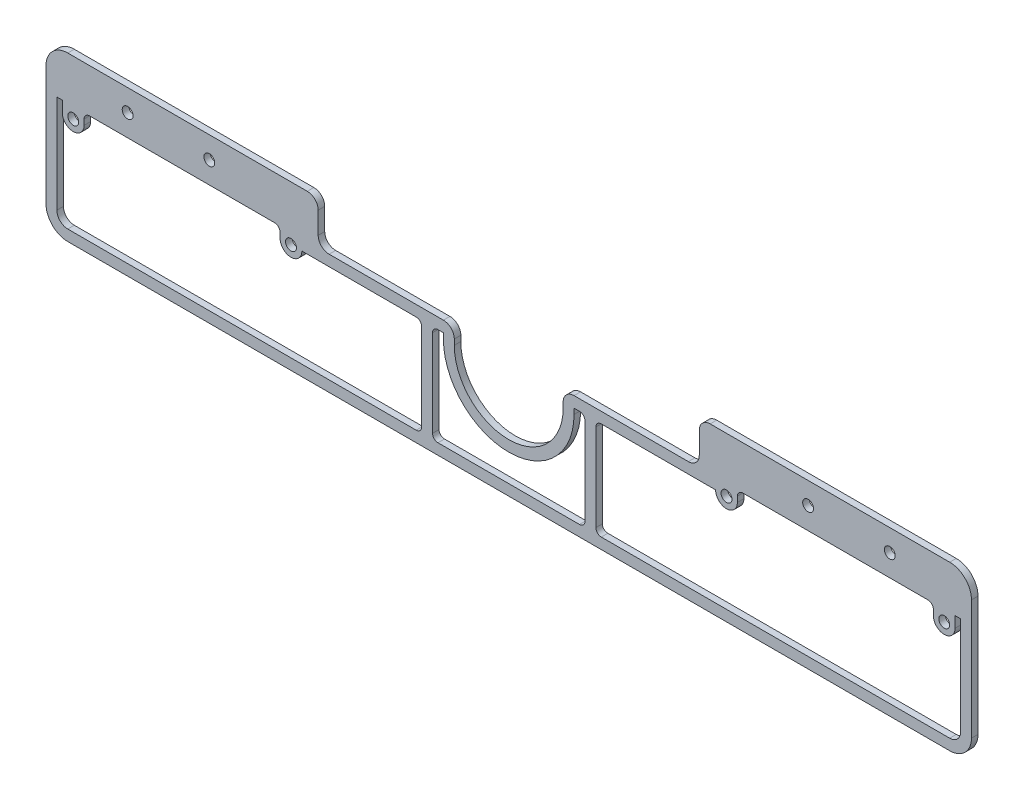
from build123d import *

# Parameters (mm, degrees)
SKETCH1_R           = 5
BOSS_EXTRUDE1_DEPTH = 6
SKETCH2_R           = 5
CUT_EXTRUDE1_DEPTH  = 436.529562716


with BuildPart() as part:
    # Sketch1 → Boss-Extrude1 (new body)
    with BuildSketch(Plane.XY):
        with BuildLine():
            Line((-425, -75), (-425, 35))
            ThreePointArc((-425, 35), (-419.142135624, 49.142135624), (-405, 55))
            Line((-405, 55), (-185.000330481, 55))
            ThreePointArc((-185.000330481, 55), (-177.92926267, 52.071067812), (-175.000330481, 45))
            Line((-175.000330481, 45), (-175.000330481, 25))
            ThreePointArc((-175.000330481, 25), (-172.071398293, 17.928932188), (-165.000330481, 15))
            Line((-165.000330481, 15), (-60, 15))
            ThreePointArc((-60, 15), (-52.928932188, 12.071067812), (-50, 5))
            Line((-50, 5), (-50, 0))
            ThreePointArc((-50, 0), (-35.355339059, -35.355339059), (0, -50))
            Line((0, -50), (0, -95))
            Line((0, -95), (-405, -95))
            ThreePointArc((-405, -95), (-419.142135624, -89.142135624), (-425, -75))
        make_face()
        with Locations((-350, 35)):
            Circle(SKETCH1_R, mode=Mode.SUBTRACT)
        with Locations((-275, 35)):
            Circle(SKETCH1_R, mode=Mode.SUBTRACT)
    boss_extrude1 = extrude(amount=BOSS_EXTRUDE1_DEPTH)

    # Mirror1: Boss-Extrude1 across plane
    add(boss_extrude1.mirror(Plane(origin=(0, -50, 6), x_dir=(0, 0, 1), z_dir=(-1, 0, 0))))

    # Sketch2 → Cut-Extrude1 (cut, through all)
    with BuildSketch(Plane.XY.offset(6)):
        with BuildLine():
            ThreePointArc((-390, 5), (-400, -5), (-410, 5))
            Line((-410, 5), (-410, 15))
            Line((-410, 15), (-415, 15))
            Line((-415, 15), (-415, -75))
            ThreePointArc((-415, -75), (-412.071067812, -82.071067812), (-405, -85))
            Line((-405, -85), (-85, -85))
            ThreePointArc((-85, -85), (-81.464466094, -83.535533906), (-80, -80))
            Line((-80, -80), (-80, 0))
            ThreePointArc((-80, 0), (-81.464466094, 3.535533906), (-85, 5))
            Line((-85, 5), (-190, 5))
            ThreePointArc((-190, 5), (-200, -5), (-210, 5))
            Line((-210, 5), (-210, 10))
            ThreePointArc((-210, 10), (-211.464466094, 13.535533906), (-215, 15))
            Line((-215, 15), (-385, 15))
            ThreePointArc((-385, 15), (-388.535533906, 13.535533906), (-390, 10))
            Line((-390, 10), (-390, 5))
        make_face()
        with BuildLine():
            ThreePointArc((-70, -80), (-68.535533906, -83.535533906), (-65, -85))
            Line((-65, -85), (0, -85))
            Line((0, -85), (0, -60))
            ThreePointArc((0, -60), (-42.426406871, -42.426406871), (-60, 0))
            Line((-60, 0), (-60, 5))
            Line((-60, 5), (-65, 5))
            ThreePointArc((-65, 5), (-68.535533906, 3.535533906), (-70, 0))
            Line((-70, 0), (-70, -80))
        make_face()
        with Locations((-400, 5)):
            Circle(SKETCH2_R)
        with Locations((-200, 5)):
            Circle(SKETCH2_R)
    cut_extrude1 = extrude(amount=-CUT_EXTRUDE1_DEPTH, mode=Mode.SUBTRACT)

    # Mirror2: Cut-Extrude1 across plane
    add(cut_extrude1.mirror(Plane(origin=(0, 0, 0), x_dir=(0, 0, 1), z_dir=(1, 0, 0))), mode=Mode.SUBTRACT)


solid = part.part
